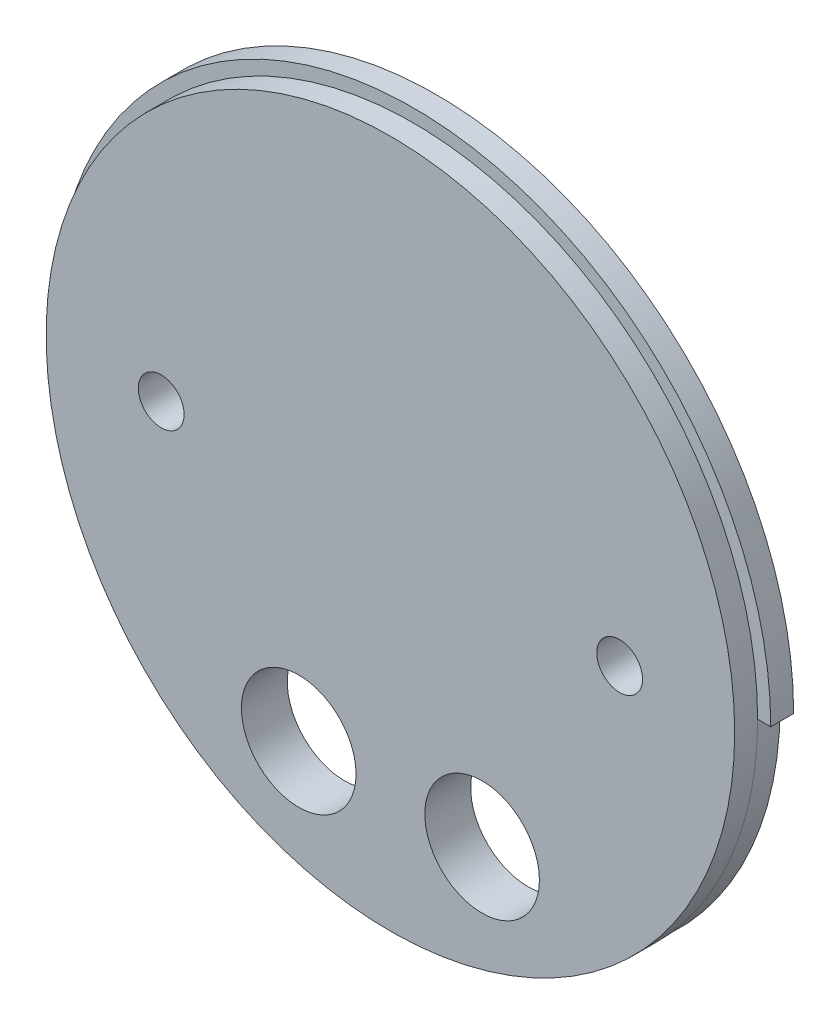
from build123d import *

# Parameters (mm, degrees)
SKETCH1_R           = 49.5046
BOSS_EXTRUDE1_DEPTH = 3.175
SKETCH2_R           = 47.6885
BOSS_EXTRUDE2_DEPTH = 3.175
SKETCH3_R           = 3.175
SKETCH3_R_2         = 7.9375
CUT_EXTRUDE1_DEPTH  = 71.297463271
CUT_EXTRUDE2_DEPTH  = 71.082033841


with BuildPart() as part:
    # Sketch1 → Boss-Extrude1 (new body)
    with BuildSketch(Plane.XY):
        Circle(SKETCH1_R)
    extrude(amount=BOSS_EXTRUDE1_DEPTH)

    # Sketch2 → Boss-Extrude2 (add)
    with BuildSketch(Plane.XY.offset(3.175)):
        Circle(SKETCH2_R)
    extrude(amount=BOSS_EXTRUDE2_DEPTH)

    # Sketch3 → Cut-Extrude1 (cut, through all)
    with BuildSketch(Plane.XY.offset(6.35)):
        with Locations((-31.75, 0)):
            Circle(SKETCH3_R)
        with Locations((31.75, 0)):
            Circle(SKETCH3_R)
        with Locations((-12.7, -31.235352443)):
            Circle(SKETCH3_R_2)
        with Locations((12.7, -31.235352443)):
            Circle(SKETCH3_R_2)
    extrude(amount=-CUT_EXTRUDE1_DEPTH, mode=Mode.SUBTRACT)

    # Sketch4 → Cut-Extrude2 (cut, through all)
    with BuildSketch(Plane.XY.offset(3.175)):
        with BuildLine():
            Line((-50.165, 0), (-47.625, 0))
            ThreePointArc((-47.625, 0), (0, -47.625), (47.625, 0))
            Line((47.625, 0), (50.165, 0))
            ThreePointArc((50.165, 0), (0, -50.165), (-50.165, 0))
        make_face()
    extrude(amount=-CUT_EXTRUDE2_DEPTH, mode=Mode.SUBTRACT)


solid = part.part
